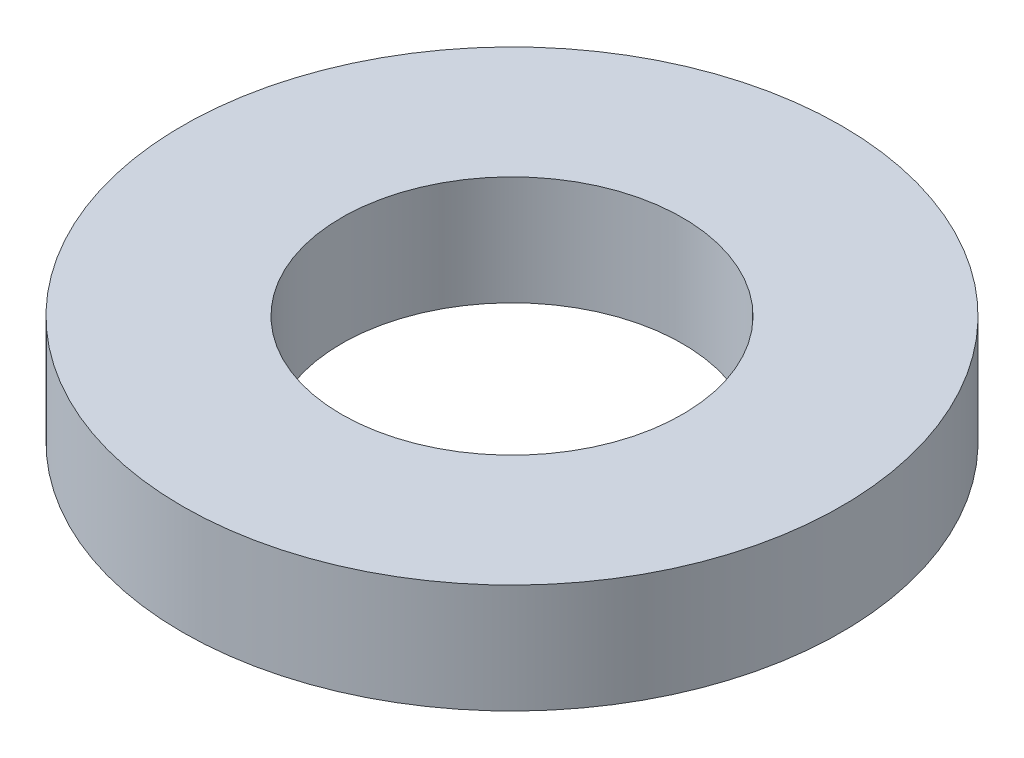
from build123d import *

# Parameters (mm, degrees)
SKETCH1_R           = 72.5
BOSS_EXTRUDE1_DEPTH = 24
SKETCH2_R           = 37.5
CUT_EXTRUDE1_DEPTH  = 106.301946801


with BuildPart() as part:
    # Sketch1 → Boss-Extrude1 (new body)
    with BuildSketch(Plane(origin=(0, 0, 0), x_dir=(1, 0, 0), z_dir=(0, 1, 0))):
        Circle(SKETCH1_R)
    extrude(amount=BOSS_EXTRUDE1_DEPTH)

    # Sketch2 → Cut-Extrude1 (cut, through all)
    with BuildSketch(Plane(origin=(0, 0, 0), x_dir=(1, 0, 0), z_dir=(0, 1, 0))):
        Circle(SKETCH2_R)
    extrude(amount=CUT_EXTRUDE1_DEPTH, mode=Mode.SUBTRACT)


solid = part.part
